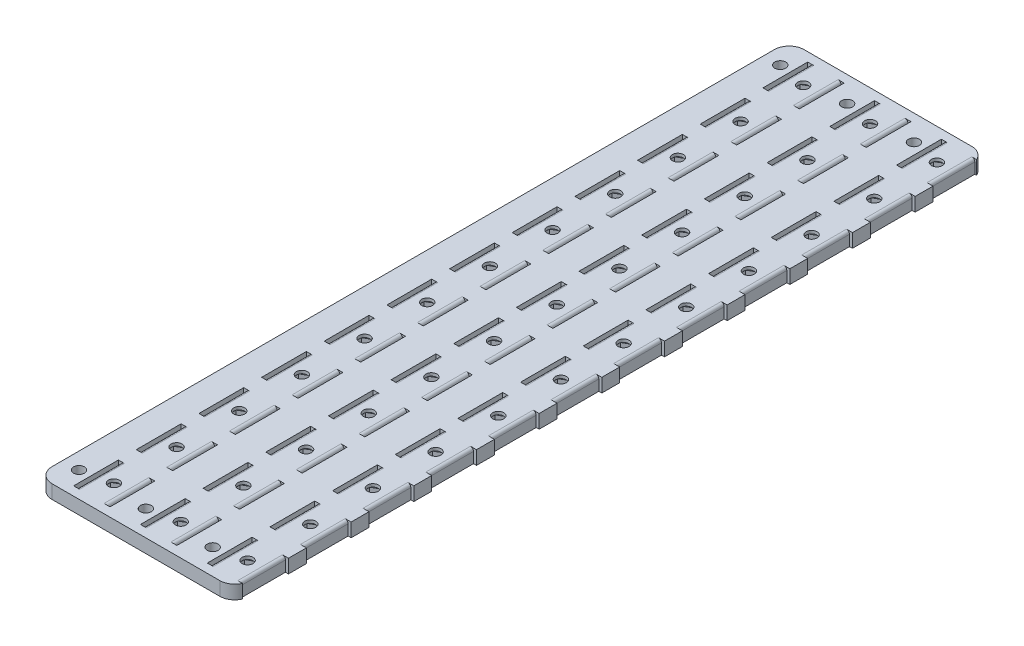
from build123d import *

# Parameters (mm, degrees)
SKETCH1_W              = 66.199999426
SKETCH1_H              = 252
BOSS_EXTRUDE1_DEPTH    = 3.571875
SKETCH2_R              = 3.175
CUT_EXTRUDE1_DEPTH     = 0.762
CUT_EXTRUDE2_DEPTH     = 131.305431117
SKETCH4_W              = 66.199999426
SKETCH4_H              = 252
BOSS_EXTRUDE2_DEPTH    = 1
SKETCH5_R              = 1.8288
CUT_EXTRUDE3_DEPTH     = 1
LPATTERN1_COUNT        = 12
LPATTERN1_PITCH        = 21
LPATTERN1_COUNT_DIR2   = 3
LPATTERN1_PITCH_DIR2   = 22.4
FILLET1_R              = 5
SKETCH7_W              = 1
SKETCH7_H              = 15
CUT_EXTRUDE4_DEPTH     = 131.355329857
FILLET5_R              = 1
LPATTERN2_COUNT        = 12
LPATTERN2_PITCH        = 21
LPATTERN2_COUNT_DIR2   = 3
LPATTERN2_PITCH_DIR2   = 22.4
FILLET5_OF_LPATTERN2_R = 1
F_6_CLEARANCE_HOLE1_D  = 3.6576
LPATTERN5_COUNT        = 3
LPATTERN5_PITCH        = 22.4
MIRROR1_COPY_1_D       = 3.6576
MIRROR1_COPY_2_D       = 3.6576


with BuildPart() as part:
    # Sketch1 → Boss-Extrude1 (new body)
    with BuildSketch(Plane(origin=(0, 0, 0), x_dir=(1, 0, 0), z_dir=(0, 1, 0))):
        Rectangle(SKETCH1_W, SKETCH1_H)
    extrude(amount=BOSS_EXTRUDE1_DEPTH)

    # Sketch2 → Cut-Extrude1 (cut)
    with BuildSketch(Plane(origin=(0, 3.571875, 0), x_dir=(1, 0, 0), z_dir=(0, 1, 0))):
        with Locations(Location((26.899999667, -115.5, 0), (0, 0, 270))):
            Circle(SKETCH2_R)
    cut_extrude1 = extrude(amount=-CUT_EXTRUDE1_DEPTH, mode=Mode.SUBTRACT)

    # Sketch3 → Cut-Extrude2 (cut, through all)
    with BuildSketch(Plane(origin=(0, 2.809875, 0), x_dir=(1, 0, 0), z_dir=(0, 1, 0))):
        Polygon((24.359999667, -114.033530316), (24.359999667, -116.966469684), (26.899999667, -118.432939367), (29.439999667, -116.966469684), (29.439999667, -114.033530316), (26.899999667, -112.567060633), align=None)
    cut_extrude2 = extrude(amount=-CUT_EXTRUDE2_DEPTH, mode=Mode.SUBTRACT)

    # Sketch4 → Boss-Extrude2 (add)
    with BuildSketch(Plane(origin=(0, 3.571875, 0), x_dir=(1, 0, 0), z_dir=(0, 1, 0))):
        Rectangle(SKETCH4_W, SKETCH4_H)
    extrude(amount=BOSS_EXTRUDE2_DEPTH)

    # Sketch5 → Cut-Extrude3 (cut)
    with BuildSketch(Plane(origin=(0, 4.571875, 0), x_dir=(1, 0, 0), z_dir=(0, 1, 0))):
        with Locations(Location((26.899999667, -115.5, 0), (0, 0, 270))):
            Circle(SKETCH5_R)
    cut_extrude3 = extrude(amount=-CUT_EXTRUDE3_DEPTH, mode=Mode.SUBTRACT)

    # LPattern1: Cut-Extrude1, Cut-Extrude2, Cut-Extrude3 12 × 3
    with Locations(*[(-j * LPATTERN1_PITCH_DIR2, 0, -i * LPATTERN1_PITCH) for i in range(LPATTERN1_COUNT) for j in range(LPATTERN1_COUNT_DIR2) if (i, j) != (0, 0)]):
        add(cut_extrude1, mode=Mode.SUBTRACT)
        add(cut_extrude2, mode=Mode.SUBTRACT)
        add(cut_extrude3, mode=Mode.SUBTRACT)

    # Fillet1
    fillet1_edges = [part.edges().sort_by_distance(p)[0] for p in [
        (-33.099999713, 2.2859375, -126),
        (33.099999713, 2.2859375, -126),
        (33.099999713, 2.2859375, 126),
        (-33.099999713, 2.2859375, 126),
    ]]
    fillet(fillet1_edges, radius=FILLET1_R)

    # Sketch7 → Cut-Extrude4 (cut, through all)
    with BuildSketch(Plane(origin=(0, 4.571875, 0), x_dir=(1, 0, 0), z_dir=(0, 1, 0))):
        with Locations((-12.199999713, -115.5)):
            Rectangle(SKETCH7_W, SKETCH7_H)
        with Locations((-23.399999713, -115.5)):
            Rectangle(SKETCH7_W, SKETCH7_H)
    cut_extrude4 = extrude(amount=-CUT_EXTRUDE4_DEPTH, mode=Mode.SUBTRACT)

    # Fillet5
    fillet5_edges = [part.edges().sort_by_distance(p)[0] for p in [
        (-12.699999713, 4.571875, 115.5),
        (-22.899999713, 4.571875, 115.5),
    ]]
    fillet(fillet5_edges, radius=FILLET5_R)

    # LPattern2: Cut-Extrude4 12 × 3
    with Locations(*[(j * LPATTERN2_PITCH_DIR2, 0, -i * LPATTERN2_PITCH) for i in range(LPATTERN2_COUNT) for j in range(LPATTERN2_COUNT_DIR2) if (i, j) != (0, 0)]):
        add(cut_extrude4, mode=Mode.SUBTRACT)

    # Fillet5 of LPattern2
    fillet5_of_lpattern2_edges = [part.edges().sort_by_distance(p)[0] for p in [
        (9.700000287, 4.571875, 115.5),
        (-0.499999713, 4.571875, 115.5),
        (32.100000287, 4.571875, 115.5),
        (21.900000287, 4.571875, 115.5),
        (-12.699999713, 4.571875, 94.5),
        (-22.899999713, 4.571875, 94.5),
        (9.700000287, 4.571875, 94.5),
        (-0.499999713, 4.571875, 94.5),
        (32.100000287, 4.571875, 94.5),
        (21.900000287, 4.571875, 94.5),
        (-12.699999713, 4.571875, 73.5),
        (-22.899999713, 4.571875, 73.5),
        (9.700000287, 4.571875, 73.5),
        (-0.499999713, 4.571875, 73.5),
        (32.100000287, 4.571875, 73.5),
        (21.900000287, 4.571875, 73.5),
        (-12.699999713, 4.571875, 52.5),
        (-22.899999713, 4.571875, 52.5),
        (9.700000287, 4.571875, 52.5),
        (-0.499999713, 4.571875, 52.5),
        (32.100000287, 4.571875, 52.5),
        (21.900000287, 4.571875, 52.5),
        (-12.699999713, 4.571875, 31.5),
        (-22.899999713, 4.571875, 31.5),
        (9.700000287, 4.571875, 31.5),
        (-0.499999713, 4.571875, 31.5),
        (32.100000287, 4.571875, 31.5),
        (21.900000287, 4.571875, 31.5),
        (-12.699999713, 4.571875, 10.5),
        (-22.899999713, 4.571875, 10.5),
        (9.700000287, 4.571875, 10.5),
        (-0.499999713, 4.571875, 10.5),
        (32.100000287, 4.571875, 10.5),
        (21.900000287, 4.571875, 10.5),
        (-12.699999713, 4.571875, -10.5),
        (-22.899999713, 4.571875, -10.5),
        (9.700000287, 4.571875, -10.5),
        (-0.499999713, 4.571875, -10.5),
        (32.100000287, 4.571875, -10.5),
        (21.900000287, 4.571875, -10.5),
        (-12.699999713, 4.571875, -31.5),
        (-22.899999713, 4.571875, -31.5),
        (9.700000287, 4.571875, -31.5),
        (-0.499999713, 4.571875, -31.5),
        (32.100000287, 4.571875, -31.5),
        (21.900000287, 4.571875, -31.5),
        (-12.699999713, 4.571875, -52.5),
        (-22.899999713, 4.571875, -52.5),
        (9.700000287, 4.571875, -52.5),
        (-0.499999713, 4.571875, -52.5),
        (32.100000287, 4.571875, -52.5),
        (21.900000287, 4.571875, -52.5),
        (-12.699999713, 4.571875, -73.5),
        (-22.899999713, 4.571875, -73.5),
        (9.700000287, 4.571875, -73.5),
        (-0.499999713, 4.571875, -73.5),
        (32.100000287, 4.571875, -73.5),
        (21.900000287, 4.571875, -73.5),
        (-12.699999713, 4.571875, -94.5),
        (-22.899999713, 4.571875, -94.5),
        (9.700000287, 4.571875, -94.5),
        (-0.499999713, 4.571875, -94.5),
        (32.100000287, 4.571875, -94.5),
        (21.900000287, 4.571875, -94.5),
        (-12.699999713, 4.571875, -115.5),
        (-22.899999713, 4.571875, -115.5),
        (9.700000287, 4.571875, -115.5),
        (-0.499999713, 4.571875, -115.5),
        (32.100000287, 4.571875, -115.5),
        (21.900000287, 4.571875, -115.5),
    ]]
    fillet(fillet5_of_lpattern2_edges, radius=FILLET5_OF_LPATTERN2_R)

    # #6 Clearance Hole1 (through all)
    with Locations(Plane(origin=(0, 4.571875, 0), x_dir=(1, 0, 0), z_dir=(0, 1, 0))):
        with Locations((-27.600000333, 117.5)):
            f_6_clearance_hole1 = Hole(F_6_CLEARANCE_HOLE1_D / 2)

    # LPattern5: #6 Clearance Hole1 ×3
    with Locations(*[(i * LPATTERN5_PITCH, 0, 0) for i in range(1, LPATTERN5_COUNT)]):
        add(f_6_clearance_hole1, mode=Mode.SUBTRACT)

    # Mirror1: #6 Clearance Hole1 across plane
    add(f_6_clearance_hole1.mirror(Plane.XY), mode=Mode.SUBTRACT)

    # Mirror1 copy 1 (through all)
    with Locations(Plane(origin=(22.4, 4.571875, 0), x_dir=(1, 0, 0), z_dir=(0, 1, 0))):
        with Locations((-27.600000333, -117.5)):
            Hole(MIRROR1_COPY_1_D / 2)

    # Mirror1 copy 2 (through all)
    with Locations(Plane(origin=(44.8, 4.571875, 0), x_dir=(1, 0, 0), z_dir=(0, 1, 0))):
        with Locations((-27.600000333, -117.5)):
            Hole(MIRROR1_COPY_2_D / 2)


solid = part.part
